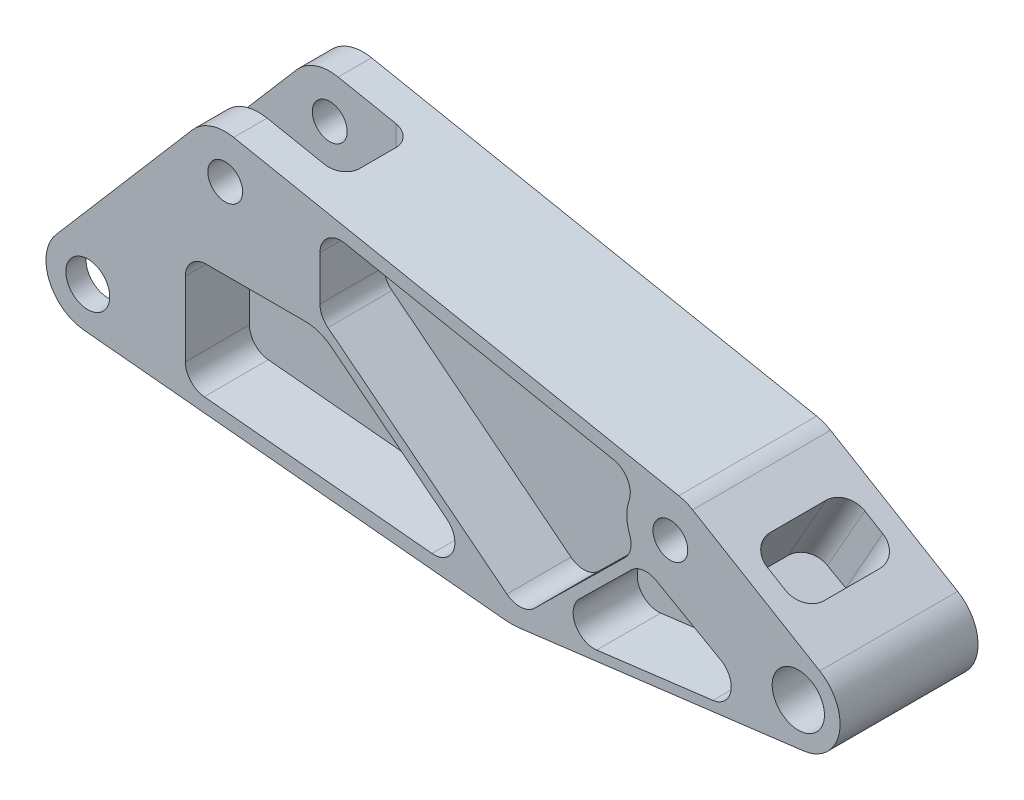
from build123d import *

# Parameters (mm, degrees)
SKETCH1_R           = 4.7625
SKETCH1_R_2         = 3.175
SKETCH1_R_3         = 4
BOSS_EXTRUDE1_DEPTH = 12.573
BOSS_EXTRUDE2_DEPTH = 0.889
SKETCH1_6_R         = 3.175
CUT_EXTRUDE1_DEPTH  = 6.477
SKETCH1_7_R         = 4
CUT_EXTRUDE2_DEPTH  = 8.89
CUT_EXTRUDE3_DEPTH  = 8.89
FILLET1_R           = 3.81
FILLET2_R           = 3.175
FILLET3_R           = 12.7


with BuildPart() as part:
    # Sketch1 → Boss-Extrude1 (new, symmetric)
    with BuildSketch(Plane(origin=(0, 0, 0), x_dir=(0, 1, 0), z_dir=(0, 0, 1))):
        with BuildLine():
            ThreePointArc((20.382390084, 19.257386231), (20.978466311, 20.483226967), (21.356021011, 21.792976878))
            Line((21.356021011, 21.792976878), (37.358021011, 102.945465221))
            ThreePointArc((37.358021011, 102.945465221), (37.070944625, 107.078516049), (34.740471159, 110.503923386))
            Line((34.740471159, 110.503923386), (5.831671261, 135.319049463))
            ThreePointArc((5.831671261, 135.319049463), (-1.978401206, 136.605306542), (-6.716685754, 130.264932046))
            Line((-6.716685754, 130.264932046), (-14.212594445, 52.146935376))
            Line((-14.212594445, 52.146935376), (-7.560895503, -0.947237667))
            ThreePointArc((-7.560895503, -0.947237667), (-1.565846257, -7.457380606), (6.54135972, -3.908326114))
            Line((6.54135972, -3.908326114), (20.382390084, 19.257386231))
        make_face()
        with BuildLine():
            Line((-7.837469994, 15.563413639), (-10.493663341, 36.765273562))
            ThreePointArc((-10.493663341, 36.765273562), (-8.373880181, 40.667929158), (-3.997617473, 39.911274641))
            Line((-3.997617473, 39.911274641), (5.30705743, 30.456131128))
            ThreePointArc((5.30705743, 30.456131128), (6.36872877, 28.282081545), (5.907210919, 25.907078618))
            Line((5.907210919, 25.907078618), (-0.741270636, 14.160362208))
            ThreePointArc((-0.741270636, 14.160362208), (-4.796024243, 12.29938936), (-7.837469994, 15.563413639))
        make_face(mode=Mode.SUBTRACT)
        Circle(SKETCH1_R, mode=Mode.SUBTRACT)
        with BuildLine():
            Line((-9.835366262, 53.132289554), (15.923267524, 85.759892349))
            ThreePointArc((15.923267524, 85.759892349), (17.252153249, 86.827671128), (18.91367086, 87.20904761))
            Line((18.91367086, 87.20904761), (27.031501436, 87.20904761))
            ThreePointArc((27.031501436, 87.20904761), (29.974660714, 85.818533808), (30.769524141, 82.661968063))
            Line((30.769524141, 82.661968063), (21.115821085, 33.704211238))
            ThreePointArc((21.115821085, 33.704211238), (19.280612759, 31.140473092), (16.14234173, 30.837161644))
            ThreePointArc((16.14234173, 30.837161644), (13.427097985, 31.264800137), (10.728808005, 30.740725275))
            ThreePointArc((10.728808005, 30.740725275), (8.557460112, 30.575295213), (6.65017035, 31.626182714))
            Line((6.65017035, 31.626182714), (-9.560561043, 48.099062569))
            ThreePointArc((-9.560561043, 48.099062569), (-10.649296851, 50.563734965), (-9.835366262, 53.132289554))
        make_face(mode=Mode.SUBTRACT)
        with Locations((13.568473709, 23.328559267)):
            Circle(SKETCH1_R_2, mode=Mode.SUBTRACT)
        with BuildLine():
            ThreePointArc((-6.271634521, 108.311010382), (-5.041237302, 110.766897358), (-2.479054789, 111.757088718))
            Line((-2.479054789, 111.757088718), (11.028473709, 111.757088718))
            ThreePointArc((11.028473709, 111.757088718), (13.722550546, 110.641165554), (14.838473709, 107.947088718))
            Line((14.838473709, 107.947088718), (14.838473709, 89.9005863))
            ThreePointArc((14.838473709, 89.9005863), (14.417020328, 87.40152116), (13.199280383, 85.178896821))
            Line((13.199280383, 85.178896821), (-3.47332856, 64.060258828))
            ThreePointArc((-3.47332856, 64.060258828), (-7.883928971, 62.885691248), (-10.256311628, 66.785025232))
            Line((-10.256311628, 66.785025232), (-6.271634521, 108.311010382))
        make_face(mode=Mode.SUBTRACT)
        with Locations((0.868473709, 129.537088718)):
            Circle(SKETCH1_R_3, mode=Mode.SUBTRACT)
        with Locations((29.570473709, 104.48104761)):
            Circle(SKETCH1_R_2, mode=Mode.SUBTRACT)
    extrude(amount=BOSS_EXTRUDE1_DEPTH, both=True)

    # Sketch1<5> → Boss-Extrude2 (add, symmetric)
    with BuildSketch(Plane(origin=(0, 0, 0), x_dir=(0, 1, 0), z_dir=(0, 0, 1))):
        with BuildLine():
            Line((11.028473709, 111.757088718), (-2.479054789, 111.757088718))
            ThreePointArc((-2.479054789, 111.757088718), (-5.041237302, 110.766897358), (-6.271634521, 108.311010382))
            Line((-6.271634521, 108.311010382), (-10.256311628, 66.785025232))
            ThreePointArc((-10.256311628, 66.785025232), (-7.883928971, 62.885691248), (-3.47332856, 64.060258828))
            Line((-3.47332856, 64.060258828), (13.199280383, 85.178896821))
            ThreePointArc((13.199280383, 85.178896821), (14.417020328, 87.40152116), (14.838473709, 89.9005863))
            Line((14.838473709, 89.9005863), (14.838473709, 107.947088718))
            ThreePointArc((14.838473709, 107.947088718), (13.722550546, 110.641165554), (11.028473709, 111.757088718))
        make_face()
        with BuildLine():
            ThreePointArc((18.91367086, 87.20904761), (17.252153249, 86.827671128), (15.923267524, 85.759892349))
            Line((15.923267524, 85.759892349), (-9.835366262, 53.132289554))
            ThreePointArc((-9.835366262, 53.132289554), (-10.649296851, 50.563734965), (-9.560561043, 48.099062569))
            Line((-9.560561043, 48.099062569), (6.65017035, 31.626182714))
            ThreePointArc((6.65017035, 31.626182714), (8.557460112, 30.575295213), (10.728808005, 30.740725275))
            ThreePointArc((10.728808005, 30.740725275), (13.427097985, 31.264800137), (16.14234173, 30.837161644))
            ThreePointArc((16.14234173, 30.837161644), (19.280612759, 31.140473092), (21.115821085, 33.704211238))
            Line((21.115821085, 33.704211238), (30.769524141, 82.661968063))
            ThreePointArc((30.769524141, 82.661968063), (29.974660714, 85.818533808), (27.031501436, 87.20904761))
            Line((27.031501436, 87.20904761), (18.91367086, 87.20904761))
        make_face()
        with BuildLine():
            ThreePointArc((-3.997617473, 39.911274641), (-8.373880181, 40.667929158), (-10.493663341, 36.765273562))
            Line((-10.493663341, 36.765273562), (-7.837469994, 15.563413639))
            ThreePointArc((-7.837469994, 15.563413639), (-4.796024243, 12.29938936), (-0.741270636, 14.160362208))
            Line((-0.741270636, 14.160362208), (5.907210919, 25.907078618))
            ThreePointArc((5.907210919, 25.907078618), (6.36872877, 28.282081545), (5.30705743, 30.456131128))
            Line((5.30705743, 30.456131128), (-3.997617473, 39.911274641))
        make_face()
    extrude(amount=BOSS_EXTRUDE2_DEPTH, both=True)

    # Sketch1<6> → Cut-Extrude1 (cut, symmetric)
    with BuildSketch(Plane(origin=(0, 0, 0), x_dir=(0, 1, 0), z_dir=(0, 0, 1))):
        with BuildLine():
            Line((16.870473709, 89.24104761), (34.655724444, 89.24104761))
            Line((34.655724444, 89.24104761), (37.358021011, 102.945465221))
            ThreePointArc((37.358021011, 102.945465221), (37.070944625, 107.078516049), (34.740471159, 110.503923386))
            Line((34.740471159, 110.503923386), (16.870473709, 125.843413136))
            Line((16.870473709, 125.843413136), (16.870473709, 89.24104761))
        make_face()
        with Locations((29.570473709, 104.48104761)):
            Circle(SKETCH1_6_R, mode=Mode.SUBTRACT)
    extrude(amount=CUT_EXTRUDE1_DEPTH, both=True, mode=Mode.SUBTRACT)

    # Sketch1<7> → Cut-Extrude2 (cut, symmetric)
    with BuildSketch(Plane(origin=(0, 0, 0), x_dir=(0, 1, 0), z_dir=(0, 0, 1))):
        with BuildLine():
            Line((14.838473709, 114.297088718), (14.838473709, 127.587668738))
            Line((14.838473709, 127.587668738), (5.831671261, 135.319049463))
            ThreePointArc((5.831671261, 135.319049463), (-1.978401206, 136.605306542), (-6.716685754, 130.264932046))
            Line((-6.716685754, 130.264932046), (-8.248899849, 114.297088718))
            Line((-8.248899849, 114.297088718), (14.838473709, 114.297088718))
        make_face()
        with Locations((0.868473709, 129.537088718)):
            Circle(SKETCH1_7_R, mode=Mode.SUBTRACT)
    extrude(amount=CUT_EXTRUDE2_DEPTH, both=True, mode=Mode.SUBTRACT)

    # Sketch1<9> → Cut-Extrude3 (cut, symmetric)
    with BuildSketch(Plane(origin=(0, 0, 0), x_dir=(0, 1, 0), z_dir=(0, 0, 1))):
        Polygon((10.542747735, 2.788791174), (16.405901968, 12.601943868), (4.298278893, 19.454693681), (-1.330811933, 9.509064286), align=None)
    extrude(amount=CUT_EXTRUDE3_DEPTH, both=True, mode=Mode.SUBTRACT)

    # Fillet1
    fillet1_edges = [part.edges().sort_by_distance(p)[0] for p in [
        (-120.942378728, 14.838473709, 8.89),
        (-120.942378728, 14.838473709, -8.89),
        (-107.542230373, 16.870473709, 6.477),
        (-107.542230373, 16.870473709, -6.477),
        (-6.14892773, 4.605967901, -8.89),
        (-16.028318774, 10.352090431, -8.89),
        (-16.028318774, 10.352090431, 8.89),
        (-6.14892773, 4.605967901, 8.89),
    ]]
    fillet(fillet1_edges, radius=FILLET1_R)

    # Fillet2
    fillet2_edges = [part.edges().sort_by_distance(p)[0] for p in [
        (-89.24104761, 27.668099077, -6.477),
        (-89.24104761, 17.986396873, -5.361076836),
        (-89.24104761, 27.668099077, 6.477),
        (-89.24104761, 17.986396873, 5.361076836),
        (-89.24104761, 16.870473709, 0),
        (-114.297088718, 1.38978693, -8.89),
        (-114.297088718, 13.722550546, -7.774076836),
        (-114.297088718, 1.38978693, 8.89),
        (-114.297088718, 13.722550546, 7.774076836),
        (-114.297088718, 14.838473709, 0),
    ]]
    fillet(fillet2_edges, radius=FILLET2_R)

    # Fillet3
    fillet3_edges = [part.edges().sort_by_distance(p)[0] for p in [
        (-52.146935376, -14.212594445, 0),
    ]]
    fillet(fillet3_edges, radius=FILLET3_R)


solid = part.part
